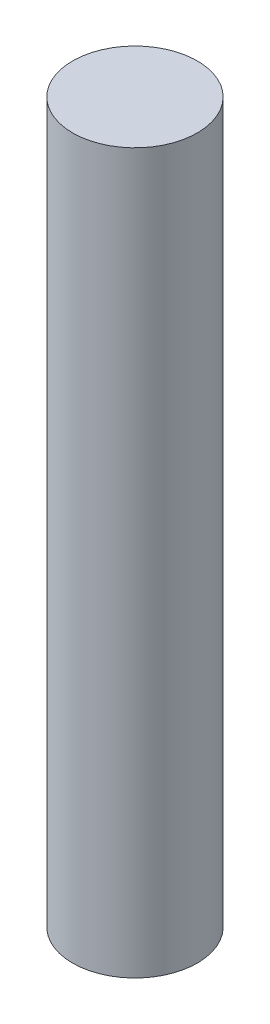
from build123d import *

# Parameters (mm, degrees)
SKETCH1_R           = 8.5
BOSS_EXTRUDE1_DEPTH = 98


with BuildPart() as part:
    # Sketch1 → Boss-Extrude1 (new body)
    with BuildSketch(Plane(origin=(0, 0, 0), x_dir=(1, 0, 0), z_dir=(0, 1, 0))):
        Circle(SKETCH1_R)
    extrude(amount=BOSS_EXTRUDE1_DEPTH)


solid = part.part
